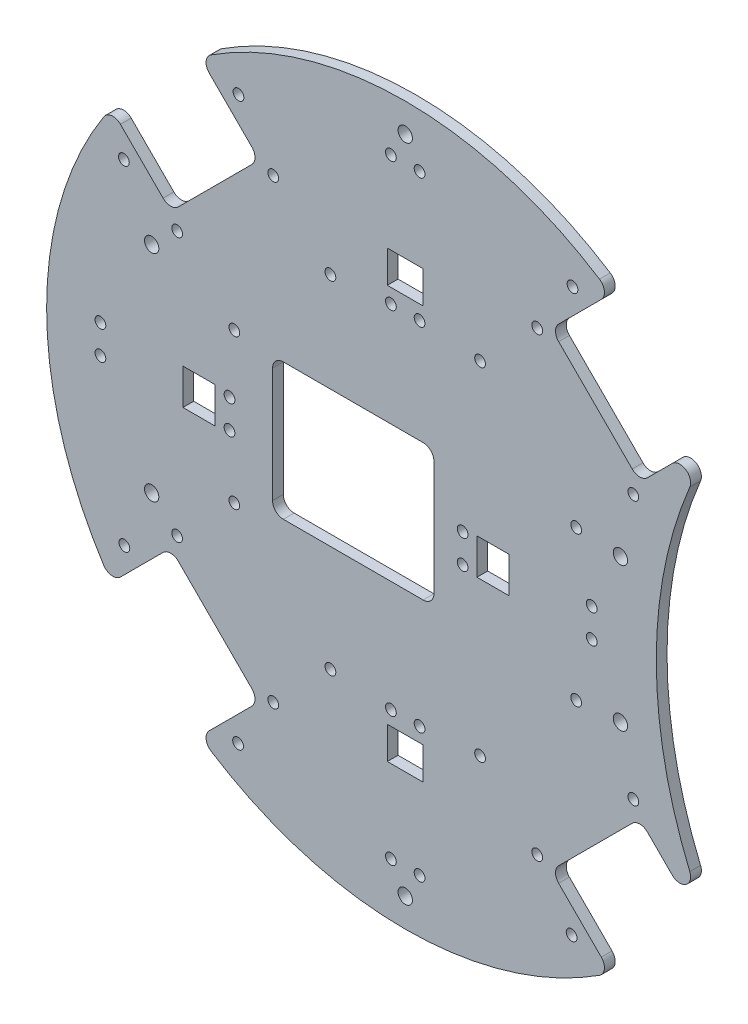
from build123d import *

# Parameters (mm, degrees)
CROQUIS1_R              = 100
SALIENTE_EXTRUIR1_DEPTH = 3
CROQUIS3_R              = 120
CORTAR_EXTRUIR1_DEPTH   = 3
CORTAR_EXTRUIR6_DEPTH   = 10
CROQUIS12_R             = 1.5
CORTAR_EXTRUIR7_DEPTH   = 142.453172464
CROQUIS9_R              = 1.5
CROQUIS9_W              = 9
CROQUIS9_H              = 10
CROQUIS9_W_2            = 10
CROQUIS9_H_2            = 9
CORTAR_EXTRUIR5_DEPTH   = 10
CROQUIS13_R             = 2
CROQUIS13_W             = 45
CROQUIS13_H             = 38
CORTAR_EXTRUIR8_DEPTH   = 142.453172464
REDONDEO2_R             = 3
REDONDEO3_R             = 3
CROQUIS14_R             = 1.5
CORTAR_EXTRUIR9_DEPTH   = 142.453172607


with BuildPart() as part:
    # Croquis1 → Saliente-Extruir1 (new body)
    with BuildSketch(Plane.XY):
        Circle(CROQUIS1_R)
    extrude(amount=SALIENTE_EXTRUIR1_DEPTH)

    # Croquis3 → Cortar-Extruir1 (cut)
    with BuildSketch(Plane.XY.offset(3)):
        with Locations((190, 0)):
            Circle(CROQUIS3_R)
    extrude(amount=-CORTAR_EXTRUIR1_DEPTH, mode=Mode.SUBTRACT)

    # Croquis5 → Cortar-Extruir6 (cut)
    with BuildSketch(Plane.XY.offset(3)):
        Polygon((-58.336309448, -83.085046789), (-83.085046789, -58.336309448), (-65.40737726, -40.658639918), (-40.658639918, -65.40737726), align=None)
        Polygon((-83.085046789, 58.336309448), (-58.336309448, 83.085046789), (-40.658639918, 65.40737726), (-65.40737726, 40.658639918), align=None)
        Polygon((58.336309448, -83.085046789), (83.085046789, -58.336309448), (65.40737726, -40.658639918), (40.658639918, -65.40737726), align=None)
        Polygon((58.336309448, 83.085046789), (83.085046789, 58.336309448), (65.40737726, 40.658639918), (40.658639918, 65.40737726), align=None)
    extrude(amount=-CORTAR_EXTRUIR6_DEPTH, mode=Mode.SUBTRACT)

    # Croquis12 → Cortar-Extruir7 (cut, through all)
    with BuildSketch(Plane.XY.offset(3)):
        with Locations((-63.604254904, -36.804908024)):
            Circle(CROQUIS12_R)
        with Locations((-36.804907897, -63.604255031)):
            Circle(CROQUIS12_R)
        with Locations((-47.666068056, -20.866721176)):
            Circle(CROQUIS12_R)
        with Locations((-20.866721049, -47.666068183)):
            Circle(CROQUIS12_R)
        with Locations(Location((47.666068183, 20.866721049, 0), (0, 0, 180))):
            Circle(CROQUIS12_R)
        with Locations(Location((20.866721176, 47.666068056, 0), (0, 0, 180))):
            Circle(CROQUIS12_R)
        with Locations(Location((63.604255031, 36.804907897, 0), (0, 0, 180))):
            Circle(CROQUIS12_R)
        with Locations(Location((36.804908024, 63.604254904, 0), (0, 0, 180))):
            Circle(CROQUIS12_R)
        with Locations((20.866721325, -47.666067908)):
            Circle(CROQUIS12_R)
        with Locations((47.666068332, -20.866720901)):
            Circle(CROQUIS12_R)
        with Locations((63.60425518, -36.804907749)):
            Circle(CROQUIS12_R)
        with Locations((36.804908173, -63.604254756)):
            Circle(CROQUIS12_R)
        with Locations(Location((-63.604254756, 36.804908173, 0), (0, 0, 180))):
            Circle(CROQUIS12_R)
        with Locations(Location((-36.804907749, 63.60425518, 0), (0, 0, 180))):
            Circle(CROQUIS12_R)
        with Locations(Location((-20.866720901, 47.666068332, 0), (0, 0, 180))):
            Circle(CROQUIS12_R)
        with Locations(Location((-47.666067908, 20.866721325, 0), (0, 0, 180))):
            Circle(CROQUIS12_R)
    extrude(amount=-CORTAR_EXTRUIR7_DEPTH, mode=Mode.SUBTRACT)

    # Croquis9 → Cortar-Extruir5 (cut)
    with BuildSketch(Plane.XY.offset(3)):
        with Locations((52, -4)):
            Circle(CROQUIS9_R)
        with Locations((16, 4)):
            Circle(CROQUIS9_R)
        with Locations((52, 4)):
            Circle(CROQUIS9_R)
        with Locations((16, -4)):
            Circle(CROQUIS9_R)
        with Locations((-85, 4)):
            Circle(CROQUIS9_R)
        with Locations((-85, -4)):
            Circle(CROQUIS9_R)
        with Locations((-49, 4)):
            Circle(CROQUIS9_R)
        with Locations((-49, -4)):
            Circle(CROQUIS9_R)
        with Locations((-4, 85)):
            Circle(CROQUIS9_R)
        with Locations((4, 85)):
            Circle(CROQUIS9_R)
        with Locations((-4, 49)):
            Circle(CROQUIS9_R)
        with Locations((4, 49)):
            Circle(CROQUIS9_R)
        with Locations((-4, -49)):
            Circle(CROQUIS9_R)
        with Locations((4, -49)):
            Circle(CROQUIS9_R)
        with Locations((4, -85)):
            Circle(CROQUIS9_R)
        with Locations((-4, -85)):
            Circle(CROQUIS9_R)
        with Locations((24.5, 0)):
            Rectangle(CROQUIS9_W, CROQUIS9_H)
        with Locations((0, -57.5)):
            Rectangle(CROQUIS9_W_2, CROQUIS9_H_2)
        with Locations((-57.5, 0)):
            Rectangle(CROQUIS9_W, CROQUIS9_H)
        with Locations((0, 57.5)):
            Rectangle(CROQUIS9_W_2, CROQUIS9_H_2)
    extrude(amount=-CORTAR_EXTRUIR5_DEPTH, mode=Mode.SUBTRACT)

    # Croquis13 → Cortar-Extruir8 (cut, through all)
    with BuildSketch(Plane.XY.offset(3)):
        with Locations((-70.710287698, 30)):
            Circle(CROQUIS13_R)
        with Locations((-70.709712289, -30)):
            Circle(CROQUIS13_R)
        with Locations((0, -92)):
            Circle(CROQUIS13_R)
        with Locations((0, 92)):
            Circle(CROQUIS13_R)
        with Locations((60, -20)):
            Circle(CROQUIS13_R)
        with Locations((60, 20)):
            Circle(CROQUIS13_R)
        with Locations((-14.5, 1)):
            Rectangle(CROQUIS13_W, CROQUIS13_H)
    extrude(amount=-CORTAR_EXTRUIR8_DEPTH, mode=Mode.SUBTRACT)

    # Redondeo2
    # the kernel refuses this fillet: 3 mm, written as the material it adds along each edge
    with BuildSketch(Plane(origin=(-37, -18, 3), x_dir=(0, 1, 0), z_dir=(0, 0, -1)), Plane(origin=(8, 20, 3), x_dir=(0, -1, 0), z_dir=(0, 0, -1)), Plane(origin=(8, -18, 3), x_dir=(-1, 0, 0), z_dir=(0, 0, -1)), Plane(origin=(40.658639918, -65.40737726, 3), x_dir=(0.7071067811865925, 0.7071067811865025, 0), z_dir=(0, 0, -1)), Plane(origin=(65.40737726, -40.658639918, 3), x_dir=(0.7071067811865014, -0.7071067811865938, 0), z_dir=(0, 0, -1)), Plane(origin=(-40.658639918, -65.40737726, 3), x_dir=(-0.7071067811865688, -0.7071067811865261, 0), z_dir=(0, 0, -1)), Plane(origin=(-65.40737726, -40.658639918, 3), x_dir=(0.7071067811865263, -0.7071067811865689, 0), z_dir=(0, 0, -1))) as redondeo2_piece_1:
        with BuildLine():
            CenterArc((REDONDEO2_R, REDONDEO2_R), REDONDEO2_R, 180, 90)
            Line((0, REDONDEO2_R), (0, 0))
            Line((0, 0), (REDONDEO2_R, 0))
        make_face()
    extrude(amount=3)
    with BuildSketch(Plane(origin=(-37, 20, 3), x_dir=(0, -1, 0), z_dir=(0, 0, -1)), Plane(origin=(-40.658639918, 65.40737726, 3), x_dir=(-0.7071067811865013, 0.7071067811865936, 0), z_dir=(0, 0, -1)), Plane(origin=(-65.40737726, 40.658639918, 3), x_dir=(0.707106781186595, 0.7071067811865002, 0), z_dir=(0, 0, -1)), Plane(origin=(40.658639918, 65.40737726, 3), x_dir=(0.707106781186525, -0.70710678118657, 0), z_dir=(0, 0, -1)), Plane(origin=(65.40737726, 40.658639918, 3), x_dir=(0.7071067811865688, 0.7071067811865261, 0), z_dir=(0, 0, -1))) as redondeo2_piece_2:
        with BuildLine():
            CenterArc((REDONDEO2_R, -REDONDEO2_R), REDONDEO2_R, 90, 90)
            Line((0, -REDONDEO2_R), (0, 0))
            Line((0, 0), (REDONDEO2_R, 0))
        make_face()
    extrude(amount=3)
    # the kernel refuses this fillet: 3 mm, written as the material it takes off along each edge
    with BuildSketch(Plane(origin=(-81.993870249, 57.245132907, 12.259512252), x_dir=(0.7071067811864988, -0.7071067811865962, 0), z_dir=(0, 0, -1)), Plane(origin=(57.245132907, 81.993870249, 12.259512252), x_dir=(-0.707106781186567, -0.707106781186528, 0), z_dir=(0, 0, -1))) as redondeo2_2_piece_1:
        with BuildLine():
            CenterArc((3.647824779, 3), REDONDEO2_R, 167.799096685, 102.200903315)
            ThreePointArc((0.715587092, 3.634020619), (0.340967474, 1.820323587), (0, 0))
            Line((0, 0), (3.647824779, 0))
        make_face()
    extrude(amount=21.519024503, mode=Mode.SUBTRACT)
    with BuildSketch(Plane(origin=(-57.245132907, 81.993870249, 12.259512252), x_dir=(0.8303993298839993, 0.5571686934207671, 0), z_dir=(0, 0, -1))) as redondeo2_2_piece_2:
        with BuildLine():
            CenterArc((3.648247827, 2.999485524), REDONDEO2_R, 168.860219289, 102.200903315)
            Line((0.704771551, 3.579095232), (0, 0))
            ThreePointArc((0, 0), (1.85190245, -0.017149184), (3.703804901, 0))
        make_face()
    extrude(amount=21.519024503, mode=Mode.SUBTRACT)
    with BuildSketch(Plane(origin=(57.245132907, -81.993870249, 12.259512252), x_dir=(-0.7071067811864988, 0.7071067811865962, 0), z_dir=(0, 0, -1)), Plane(origin=(-81.993870249, -57.245132907, 12.259512252), x_dir=(0.707106781186568, 0.707106781186527, 0), z_dir=(0, 0, -1))) as redondeo2_2_piece_3:
        with BuildLine():
            CenterArc((3.647824779, -3), REDONDEO2_R, 90, 102.200903315)
            ThreePointArc((0.715587092, -3.634020619), (0.340967474, -1.820323587), (0, 0))
            Line((0, 0), (3.647824779, 0))
        make_face()
    extrude(amount=21.519024503, mode=Mode.SUBTRACT)
    with BuildSketch(Plane(origin=(81.993870249, -57.245132907, 11.583056929), x_dir=(0.5619940188878753, 0.8271412955077593, 0), z_dir=(0, 0, -1))) as redondeo2_2_piece_4:
        with BuildLine():
            CenterArc((3.590487142, -2.809879123), REDONDEO2_R, 110.507494251, 80.298695839)
            Line((0.643686139, -3.372341435), (0, 0))
            ThreePointArc((0, 0), (1.269748729, 0.008061634), (2.539497458, 0))
        make_face()
    extrude(amount=20.166113858, mode=Mode.SUBTRACT)
    with BuildSketch(Plane(origin=(81.993870249, 57.245132907, 11.583056929), x_dir=(0.5619940188878358, -0.827141295507786, 0), z_dir=(0, 0, -1))) as redondeo2_2_piece_5:
        with BuildLine():
            CenterArc((3.590487142, 2.809879123), REDONDEO2_R, 169.19380991, 80.298695839)
            Line((0.643686139, 3.372341435), (0, 0))
            ThreePointArc((0, 0), (1.269748729, -0.008061634), (2.539497458, 0))
        make_face()
    extrude(amount=20.166113858, mode=Mode.SUBTRACT)
    with BuildSketch(Plane(origin=(-57.245132907, -81.993870249, 12.259512252), x_dir=(0.8303993298839483, -0.5571686934208434, 0), z_dir=(0, 0, -1))) as redondeo2_2_piece_6:
        with BuildLine():
            CenterArc((3.648247827, -2.999485524), REDONDEO2_R, 88.938877397, 102.200903315)
            Line((0.704771551, -3.579095232), (0, 0))
            ThreePointArc((0, 0), (1.85190245, 0.017149184), (3.703804901, 0))
        make_face()
    extrude(amount=21.519024503, mode=Mode.SUBTRACT)

    # Redondeo3
    redondeo3_edges = [part.edges().sort_by_distance(p)[0] for p in [
        (83.421052632, -55.14460969, 1.5),
        (83.421052632, 55.14460969, 1.5),
    ]]
    fillet(redondeo3_edges, radius=REDONDEO3_R)

    # Croquis14 → Cortar-Extruir9 (cut, through all)
    with BuildSketch(Plane.XY.offset(3)):
        with Locations((46.390099465, -78.209904618)):
            Circle(CROQUIS14_R)
        with Locations((-46.613889508, -78.433694662)):
            Circle(CROQUIS14_R)
        with Locations((-78.318210918, -46.498405764)):
            Circle(CROQUIS14_R)
        with Locations((-78.455342963, 46.63553781)):
            Circle(CROQUIS14_R)
        with Locations((-46.498405821, 78.318210974)):
            Circle(CROQUIS14_R)
        with Locations((46.63553784, 78.455342993)):
            Circle(CROQUIS14_R)
    extrude(amount=-CORTAR_EXTRUIR9_DEPTH, mode=Mode.SUBTRACT)


solid = part.part
